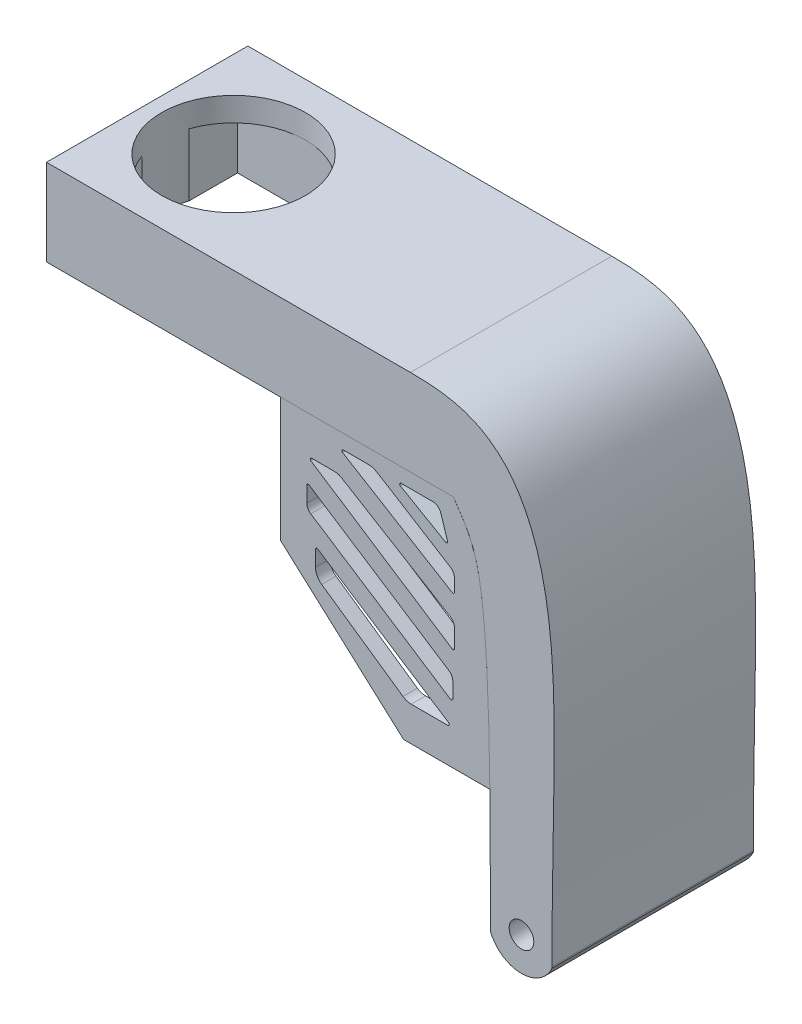
from build123d import *

# Parameters (mm, degrees)
EXTRUDE_4_OUTLINE_R = 4.285714286
EXTRUDE_4_DEPTH     = 70
CUT_EXTRUDE_START   = -25
CUT_EXTRUDE_2_DEPTH = 50
SKETCH_7_R          = 5
EXTRUDE_5_DEPTH     = 25
EXTRUDE_6_DEPTH     = 70
CUT_EXTRUDE_6_DEPTH = 30
CUT_EXTRUDE_7_DEPTH = 70
SKETCH_8_R          = 25
CUT_EXTRUDE_8_DEPTH = 217.032803357


# Read off the part's stored shape, not the designer's step: 凸台-拉伸4, 切除-拉伸2
with BuildPart() as part:
    # 凸台-拉伸4 outline → 凸台-拉伸4 (new body)
    with BuildSketch(Plane.XY):
        with BuildLine():
            add(Edge.make_bspline(
                [(75.081633224, 98.571428571), (102.857142857, 98.571428571), (121.659276484, 92.374392302), (129.417645806, 45.243229107), (124.285714286, 23.323110609), (124.285714286, -55.714285714)],
                knots=[0, 0, 0, 0, 0, 0, 1, 1, 1, 1, 1, 1], degree=5))
            Line((75.081633224, 98.571428571), (-51.428571429, 98.571428571))
            Line((-51.428571429, 98.571428571), (-51.428571429, 68.571428571))
            Line((-51.428571429, 68.571428571), (90, 68.571428571))
            add(Edge.make_bspline(
                [(90, 68.571428571), (96.36599167, 59.54355384), (98.963568623, 54.221078955), (102.934822038, 47.492908651), (102.857142857, -41.428571429)],
                knots=[0, 0, 0, 0, 0, 1, 1, 1, 1, 1], degree=4))
            Line((102.857142857, -41.428571429), (102.857142857, -55.710657963))
            ThreePointArc((102.857142857, -55.710657963), (113.404555332, -63.062666636), (124.285714286, -56.214285714))
            Line((124.285714286, -56.214285714), (124.285714286, -55.714285714))
        make_face()
        with Locations((113.677987148, -51.428571429)):
            Circle(EXTRUDE_4_OUTLINE_R, mode=Mode.SUBTRACT)
    extrude(amount=EXTRUDE_4_DEPTH)

    # 切除-拉伸2 outline → 切除-拉伸2 (cut)
    with BuildSketch(Plane(origin=(0, 0, 35), x_dir=(-1, 0, 0), z_dir=(0, 0, -1)).offset(CUT_EXTRUDE_START)):
        with BuildLine():
            Line((45, 90.273802118), (-86.614413472, 90.273802118))
            add(Edge.make_bspline(
                [(-86.614413472, 90.273802118), (-88.360672067, 90.273802118), (-100.747489611, 79.982143538), (-111.955468631, 73.182510666), (-113.70977154, 53.381496527), (-113.677987148, -41.428571429)],
                knots=[0, 0, 0, 0, 0, 0, 1, 1, 1, 1, 1, 1], degree=5))
            Line((-113.677987148, -41.428571429), (-102.857142857, -41.428571429))
            add(Edge.make_bspline(
                [(-90, 68.571428571), (-96.36599167, 59.54355384), (-98.963568623, 54.221078955), (-102.934822038, 47.492908651), (-102.857142857, -41.428571429)],
                knots=[0, 0, 0, 0, 0, 1, 1, 1, 1, 1], degree=4))
            Line((-90, 68.571428571), (45, 68.571428571))
            Line((45, 68.571428571), (45, 90.273802118))
        make_face()
    extrude(amount=CUT_EXTRUDE_2_DEPTH, mode=Mode.SUBTRACT)

    # 草图7 → 凸台-拉伸5 (add, symmetric)
    with BuildSketch(Plane(origin=(0, 0, 35), x_dir=(-1, 0, 0), z_dir=(0, 0, -1))):
        with Locations(Location((-80.081633224, 78.571428571, 0), (0, 0, 180))):
            Circle(SKETCH_7_R)
    extrude(amount=EXTRUDE_5_DEPTH, both=True)

    # 草图8 → 切除-拉伸8 (cut, through all)
    with BuildSketch(Plane(origin=(0, 98.571428571, 0), x_dir=(1, 0, 0), z_dir=(0, 1, 0))):
        with Locations(Location((-21.385187258, -35, 0), (0, 0, 270))):
            Circle(SKETCH_8_R)
    extrude(amount=-CUT_EXTRUDE_8_DEPTH, mode=Mode.SUBTRACT)


with BuildPart() as body_2:
    # 草图9 → 凸台-拉伸6 (new body)
    with BuildSketch(Plane(origin=(0, 0, 0), x_dir=(-1, 0, 0), z_dir=(0, 0, -1))):
        Polygon((-90, 68.571428571), (-30, 68.571428571), (-30, 25.346918923), (-72.702476388, -13.106120193), (-102.702476388, -13.106120193), (-102.44444362, 1.082840235), (-102.236617695, 8.571428571), (-102.198423739, 9.746413711), (-102.145582847, 11.292681667), (-101.945866973, 16.454335633), (-101.497880218, 25.346918923), (-100.921481237, 33.526965652), (-100.303739645, 39.891169232), (-99.558557747, 45.514323537), (-99.05045056, 48.473671229), (-97.823809945, 53.730411853), (-96.076586146, 58.568173195), (-93.943653788, 62.619959209), align=None)
    extrude(amount=-EXTRUDE_6_DEPTH)

    # 草图11 → 切除-拉伸6 (cut, symmetric)
    with BuildSketch(Plane(origin=(0, 0, 35), x_dir=(-1, 0, 0), z_dir=(0, 0, -1))):
        Polygon((-30, 68.571428571), (-30, 25.346918923), (-72.702476388, -13.106120193), (-102.702476388, -13.106120193), (-101.149723015, -7.841039459), (-101.149723015, 18.484825681), (-100.196566525, 27.023468843), (-97.971172378, 46.959173747), (-95.449059012, 57.288829242), (-90, 68.571428571), align=None)
    extrude(amount=CUT_EXTRUDE_6_DEPTH, both=True, mode=Mode.SUBTRACT)

    # 草图12 → 切除-拉伸7 (cut)
    with BuildSketch(Plane(origin=(0, 0, 0), x_dir=(-1, 0, 0), z_dir=(0, 0, -1))):
        with BuildLine():
            Line((-82.809680545, 63.571428571), (-71.866025404, 63.571428571))
            ThreePointArc((-71.866025404, 63.571428571), (-71.383062491, 63.200838094), (-71.616025404, 62.63841587))
            Line((-71.616025404, 62.63841587), (-87.276191195, 53.597014935))
            ThreePointArc((-87.276191195, 53.597014935), (-87.839945672, 53.640722964), (-88.002433897, 54.182319751))
            Line((-88.002433897, 54.182319751), (-85.667136762, 61.485181257))
            ThreePointArc((-85.667136762, 61.485181257), (-84.578683364, 62.99436667), (-82.809680545, 63.571428571))
        make_face()
        with BuildLine():
            Line((-67.851473283, 60.025720365), (-63.194491567, 62.847624779))
            ThreePointArc((-63.194491567, 62.847624779), (-61.948504742, 63.387079153), (-60.60332465, 63.571428571))
            Line((-60.60332465, 63.571428571), (-51.789965005, 63.571428571))
            ThreePointArc((-51.789965005, 63.571428571), (-51.308399947, 63.205946581), (-51.530848314, 62.643808951))
            Line((-51.530848314, 62.643808951), (-89.613485287, 39.567583206))
            ThreePointArc((-89.613485287, 39.567583206), (-90.118001301, 39.559566312), (-90.372601979, 39.995202827))
            Line((-90.372601979, 39.995202827), (-90.372601979, 44.367671677))
            ThreePointArc((-90.372601979, 44.367671677), (-89.994531814, 45.825575631), (-88.955612686, 46.916019592))
            Line((-88.955612686, 46.916019592), (-67.851473283, 60.025720365))
        make_face()
        with BuildLine():
            Line((-48.60332465, 55.571428571), (-40.768432632, 55.571428571))
            ThreePointArc((-40.768432632, 55.571428571), (-40.289177357, 55.213957101), (-40.495202434, 54.652686098))
            Line((-40.495202434, 54.652686098), (-89.599371781, 22.612129473))
            ThreePointArc((-89.599371781, 22.612129473), (-90.110703744, 22.591204402), (-90.372601979, 23.030871946))
            Line((-90.372601979, 23.030871946), (-90.372601979, 29.4176591))
            ThreePointArc((-90.372601979, 29.4176591), (-89.986421067, 30.890055031), (-88.927302129, 31.983376825))
            Line((-88.927302129, 31.983376825), (-51.194491567, 54.847624779))
            ThreePointArc((-51.194491567, 54.847624779), (-49.948504742, 55.387079153), (-48.60332465, 55.571428571))
        make_face()
        with BuildLine():
            Line((-89.805499039, 13.005694634), (-89.805499039, 7.555447176))
            ThreePointArc((-89.805499039, 7.555447176), (-89.544078419, 7.11603862), (-89.033179522, 7.136111892))
            Line((-89.033179522, 7.136111892), (-40.453254672, 38.684283967))
            ThreePointArc((-40.453254672, 38.684283967), (-39.450720439, 39.76881939), (-39.087171777, 41.20029567))
            Line((-39.087171777, 41.20029567), (-39.087171777, 46.650543128))
            ThreePointArc((-39.087171777, 46.650543128), (-39.348592397, 47.089951685), (-39.859491294, 47.069878412))
            Line((-39.859491294, 47.069878412), (-88.439416144, 15.521706338))
            ThreePointArc((-88.439416144, 15.521706338), (-89.441950377, 14.437170915), (-89.805499039, 13.005694634))
        make_face()
        with BuildLine():
            Line((-77.805499039, 6.634561733), (-42.863642809, 29.32606849))
            ThreePointArc((-42.863642809, 29.32606849), (-42.352743911, 29.346141762), (-42.091323291, 28.906733206))
            Line((-42.091323291, 28.906733206), (-42.091323291, 23.443947911))
            ThreePointArc((-42.091323291, 23.443947911), (-42.661176029, 21.125803127), (-44.240841386, 19.336058805))
            Line((-44.240841386, 19.336058805), (-72.490093284, -0.266218492))
            ThreePointArc((-72.490093284, -0.266218492), (-73.847163915, -0.930092452), (-75.340575189, -1.158329385))
            Line((-75.340575189, -1.158329385), (-88.117527328, -1.158329385))
            ThreePointArc((-88.117527328, -1.158329385), (-88.596937195, -0.800337058), (-88.389846845, -0.238994101))
            Line((-88.389846845, -0.238994101), (-77.805499039, 6.634561733))
        make_face()
    extrude(amount=-CUT_EXTRUDE_7_DEPTH, mode=Mode.SUBTRACT)


solid = Compound([part.part, body_2.part])
